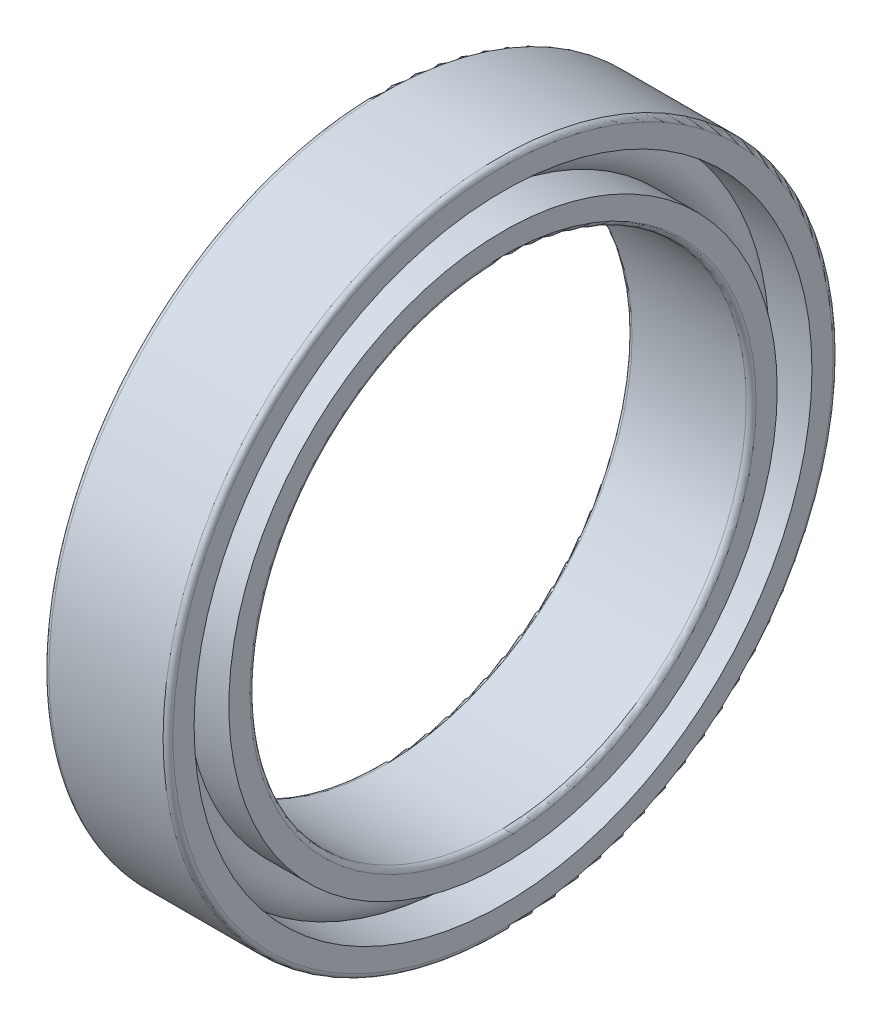
from build123d import *

# Parameters (mm, degrees)
CAGSPISKE_W     = 0.21
CAGSPISKE_H     = 0.35
CAGESPINE_ANGLE = 0.001
BALSIMSKE_R     = 1.05


with BuildPart() as part:
    # CagSpiSke → CageSpine (revolve)
    with BuildSketch(Plane.XY):
        with Locations((0, 11.75)):
            Rectangle(CAGSPISKE_W, CAGSPISKE_H)
    revolve(axis=Axis((-20.6375, 0, 0), (-1, 0, 0)), revolution_arc=CAGESPINE_ANGLE)

    # BalSimSke → BallsSimplified (revolve)
    with BuildSketch(Plane.XY):
        with Locations((0, 11.75)):
            Circle(BALSIMSKE_R)
    revolve(axis=Axis((-10, 0, 0), (1, 0, 0)))

    # InnRacSke → InnerRace (revolve)
    with BuildSketch(Plane.XY):
        with BuildLine():
            Line((-0.748748957, 11.05), (-2.5, 11.05))
            Line((-2.5, 11.05), (-2.5, 10.2))
            ThreePointArc((-2.5, 10.2), (-2.441421356, 10.058578644), (-2.3, 10))
            Line((-2.3, 10), (2.3, 10))
            ThreePointArc((2.3, 10), (2.441421356, 10.058578644), (2.5, 10.2))
            Line((2.5, 10.2), (2.5, 11.05))
            Line((2.5, 11.05), (0.748748957, 11.05))
            ThreePointArc((0.748748957, 11.05), (0, 10.725), (-0.748748957, 11.05))
        make_face()
    revolve(axis=Axis((-20.6375, 0, 0), (1, 0, 0)))

    # OutRacSke → OuterRace (revolve)
    with BuildSketch(Plane.XY):
        with BuildLine():
            Line((-0.748748957, 12.45), (-2.5, 12.45))
            Line((-2.5, 12.45), (-2.5, 13.3))
            ThreePointArc((-2.5, 13.3), (-2.441421356, 13.441421356), (-2.3, 13.5))
            Line((-2.3, 13.5), (2.3, 13.5))
            ThreePointArc((2.3, 13.5), (2.441421356, 13.441421356), (2.5, 13.3))
            Line((2.5, 13.3), (2.5, 12.45))
            Line((2.5, 12.45), (0.748748957, 12.45))
            ThreePointArc((0.748748957, 12.45), (0, 12.775), (-0.748748957, 12.45))
        make_face()
    revolve(axis=Axis((-20.6375, 0, 0), (1, 0, 0)))


solid = part.part
